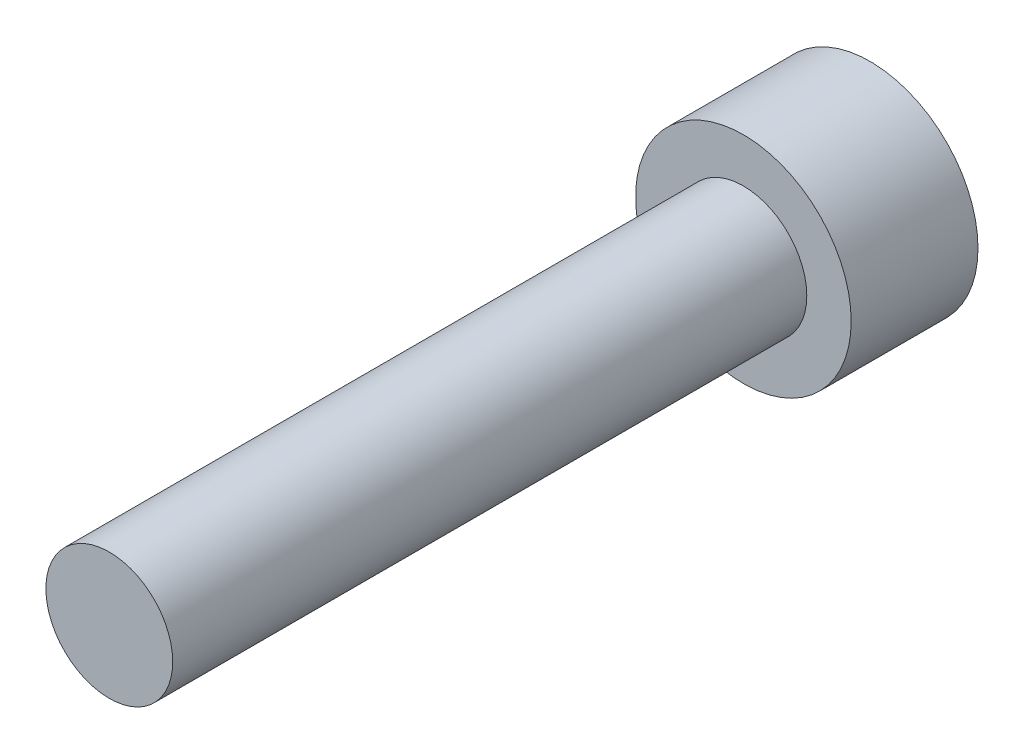
from build123d import *

# Parameters (mm, degrees)
SKETCH1_R           = 4.25
BOSS_EXTRUDE3_DEPTH = 5
SKETCH1_3_R         = 2.5
BOSS_EXTRUDE4_DEPTH = 25


with BuildPart() as part:
    # Sketch1 → Boss-Extrude3 (new body)
    with BuildSketch(Plane.XY):
        Circle(SKETCH1_R)
    extrude(amount=-BOSS_EXTRUDE3_DEPTH)

    # Sketch1<3> → Boss-Extrude4 (add)
    with BuildSketch(Plane.XY):
        Circle(SKETCH1_3_R)
    extrude(amount=BOSS_EXTRUDE4_DEPTH)


solid = part.part
